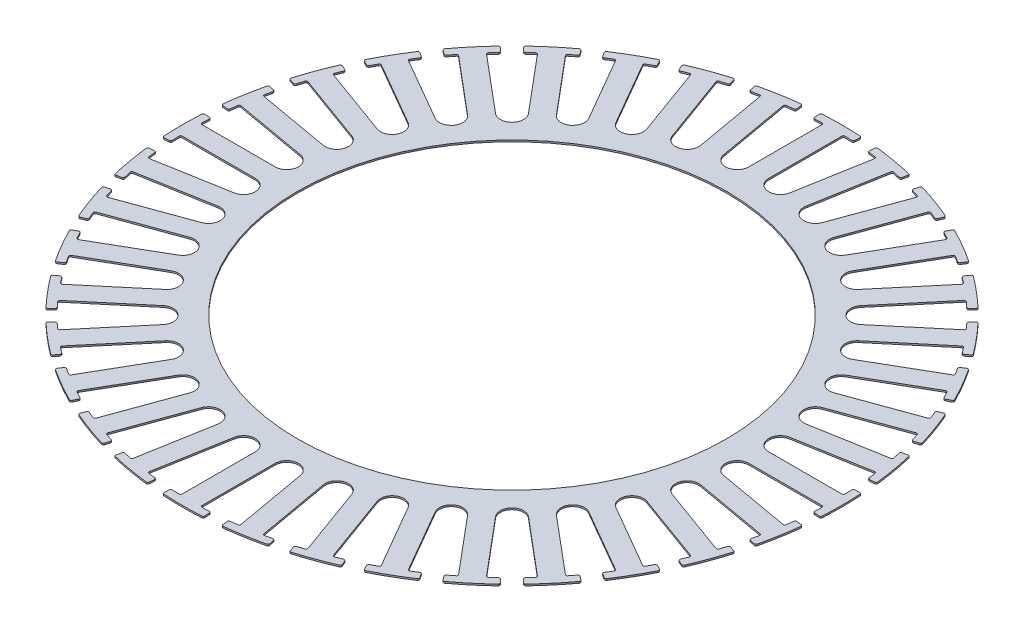
from build123d import *

# Parameters (mm, degrees)
P_IDAT_VYSUNUT_M1_DEPTH = 0.2
ZAOBLIT2_R              = 0.2
KRUHOV_POLE1_DEPTH      = 0.2


# Read off the part's stored shape, not the designer's step: Kruhové pole1
with BuildPart() as part:
    # Skica1 → Přidat vysunutím1 (new body)
    with BuildSketch(Plane(origin=(0, 0, 0), x_dir=(1, 0, 0), z_dir=(0, 1, 0))):
        with BuildLine():
            Line((-2.569801004, 41.420358796), (-2.507878089, 40.422277861))
            ThreePointArc((-2.507878089, 40.422277861), (-1.879166138, 40.456380642), (-1.25, 40.48070528))
            Line((-1.25, 40.48070528), (-1.25, 31.073947021))
            Line((-1.25, 31.073947021), (-1.085241159, 26.978181029))
            ThreePointArc((-1.085241159, 26.978181029), (1.270191917, 26.970105904), (3.615958065, 26.756771989))
            Line((3.615958065, 26.756771989), (4.164924582, 30.818924165))
            ThreePointArc((4.164924582, 30.818924165), (2.590619594, 29.610917461), (1.25, 31.073947021))
            Line((1.25, 31.073947021), (1.25, 40.48070528))
            ThreePointArc((1.25, 40.48070528), (1.879166138, 40.456380642), (2.507878089, 40.422277861))
            Line((2.507878089, 40.422277861), (2.569801004, 41.420358796))
            ThreePointArc((2.569801004, 41.420358796), (0, 41.5), (-2.569801004, 41.420358796))
        make_face()
    extrude(amount=P_IDAT_VYSUNUT_M1_DEPTH)

    # Zaoblit2
    zaoblit2_edges = [part.edges().sort_by_distance(p)[0] for p in [
        (-2.507878089, 0.1, -40.422277861),
        (-2.569801004, 0.1, -41.420358796),
        (2.569801004, 0.1, -41.420358796),
        (2.507878089, 0.1, -40.422277861),
        (1.25, 0.1, -40.48070528),
        (-1.25, 0.1, -40.48070528),
    ]]
    fillet(zaoblit2_edges, radius=ZAOBLIT2_R)

    # Kruhové pole1 outline → Kruhové pole1 (add)
    with BuildSketch(Plane(origin=(0, 0, 0), x_dir=(1, 0, 0), z_dir=(0, 1, 0))):
        with BuildLine():
            ThreePointArc((-9.535776959, 39.566639455), (-9.446113134, 39.443136268), (-9.295440541, 39.418837948))
            ThreePointArc((-9.295440541, 39.418837948), (-8.879840332, 39.514534486), (-8.463255471, 39.605849402))
            ThreePointArc((-8.463255471, 39.605849402), (-8.309712699, 39.576132918), (-8.224500066, 39.444994596))
            Line((-8.224500066, 39.444994596), (-6.626943964, 30.384803721))
            ThreePointArc((-6.626943964, 30.384803721), (-7.693144117, 28.711204717), (-9.453300038, 29.627483893))
            Line((-9.453300038, 29.627483893), (-12.599871307, 38.272617405))
            ThreePointArc((-12.599871307, 38.272617405), (-12.591644164, 38.42879284), (-12.473530464, 38.531299456))
            ThreePointArc((-12.473530464, 38.531299456), (-12.067099933, 38.66051085), (-11.659331326, 38.785435321))
            ThreePointArc((-11.659331326, 38.785435321), (-11.540994193, 38.88181458), (-11.525094636, 39.03360339))
            Line((-11.525094636, 39.03360339), (-11.695001824, 39.609051142))
            ThreePointArc((-11.695001824, 39.609051142), (-11.791655425, 39.728326768), (-11.94437873, 39.74395321))
            ThreePointArc((-11.94437873, 39.74395321), (-14.193835948, 38.997243763), (-16.396995731, 38.123333157))
            ThreePointArc((-16.396995731, 38.123333157), (-16.503944086, 38.01319396), (-16.501316146, 37.859695792))
            Line((-16.501316146, 37.859695792), (-16.261581918, 37.309663005))
            ThreePointArc((-16.261581918, 37.309663005), (-16.151834185, 37.203606068), (-15.999231288, 37.205840915))
            ThreePointArc((-15.999231288, 37.205840915), (-15.60656251, 37.372251827), (-15.212163177, 37.534518666))
            ThreePointArc((-15.212163177, 37.534518666), (-15.055792851, 37.531916065), (-14.949102859, 37.417567047))
            Line((-14.949102859, 37.417567047), (-11.80253159, 28.772433535))
            ThreePointArc((-11.80253159, 28.772433535), (-12.56191635, 26.939116547), (-14.454441756, 27.535827516))
            Line((-14.454441756, 27.535827516), (-19.054421217, 35.503225657))
            ThreePointArc((-19.054421217, 35.503225657), (-19.073438642, 35.658457064), (-18.974919442, 35.779916603))
            ThreePointArc((-18.974919442, 35.779916603), (-18.597100828, 35.977740907), (-18.217220048, 36.17157577))
            ThreePointArc((-18.217220048, 36.17157577), (-18.117416804, 36.28703984), (-18.128116648, 36.439283566))
            Line((-18.128116648, 36.439283566), (-18.395368018, 36.976484899))
            ThreePointArc((-18.395368018, 36.976484899), (-18.511265228, 37.077164739), (-18.664381826, 37.066033657))
            ThreePointArc((-18.664381826, 37.066033657), (-20.75, 35.940054257), (-22.767935851, 34.696845636))
            ThreePointArc((-22.767935851, 34.696845636), (-22.85413395, 34.569808313), (-22.824891256, 34.419098465))
            Line((-22.824891256, 34.419098465), (-22.493286939, 33.919051323))
            ThreePointArc((-22.493286939, 33.919051323), (-22.366789927, 33.833663123), (-22.216893488, 33.862363233))
            ThreePointArc((-22.216893488, 33.862363233), (-21.859087183, 34.094432207), (-21.498857003, 34.322720574))
            ThreePointArc((-21.498857003, 34.322720574), (-21.344410357, 34.347310934), (-21.219484727, 34.253225657))
            Line((-21.219484727, 34.253225657), (-16.619505265, 26.285827516))
            ThreePointArc((-16.619505265, 26.285827516), (-17.049001111, 24.348496953), (-19.016392575, 24.607508953))
            Line((-19.016392575, 24.607508953), (-24.930012181, 31.655086363))
            ThreePointArc((-24.930012181, 31.655086363), (-24.975696339, 31.804657116), (-24.899765095, 31.941379091))
            ThreePointArc((-24.899765095, 31.941379091), (-24.562038224, 32.201805513), (-24.221587758, 32.458661194))
            ThreePointArc((-24.221587758, 32.458661194), (-24.143350875, 32.589701756), (-24.180325009, 32.737774549))
            Line((-24.180325009, 32.737774549), (-24.536800263, 33.220406874))
            ThreePointArc((-24.536800263, 33.220406874), (-24.668419605, 33.299431821), (-24.817277126, 33.261881427))
            ThreePointArc((-24.817277126, 33.261881427), (-26.675685802, 31.790844389), (-28.447083762, 30.216112018))
            ThreePointArc((-28.447083762, 30.216112018), (-28.509912518, 30.076036535), (-28.454943596, 29.932694248))
            Line((-28.454943596, 29.932694248), (-28.041544819, 29.497826431))
            ThreePointArc((-28.041544819, 29.497826431), (-27.902142075, 29.435701446), (-27.759506622, 29.48999478))
            ThreePointArc((-27.759506622, 29.48999478), (-27.447434553, 29.780670518), (-27.132318937, 30.068043985))
            ThreePointArc((-27.132318937, 30.068043985), (-26.984488754, 30.119080141), (-26.845123288, 30.048117339))
            Line((-26.845123288, 30.048117339), (-20.931503683, 23.000539929))
            ThreePointArc((-20.931503683, 23.000539929), (-21.0180606, 21.0180606), (-23.000539929, 20.931503683))
            Line((-23.000539929, 20.931503683), (-30.048117339, 26.845123288))
            ThreePointArc((-30.048117339, 26.845123288), (-30.119080141, 26.984488754), (-30.068043985, 27.132318937))
            ThreePointArc((-30.068043985, 27.132318937), (-29.780670518, 27.447434553), (-29.48999478, 27.759506622))
            ThreePointArc((-29.48999478, 27.759506622), (-29.435701446, 27.902142075), (-29.497826431, 28.041544819))
            Line((-29.497826431, 28.041544819), (-29.932694248, 28.454943596))
            ThreePointArc((-29.932694248, 28.454943596), (-30.076036535, 28.509912518), (-30.216112018, 28.447083762))
            ThreePointArc((-30.216112018, 28.447083762), (-31.790844389, 26.675685802), (-33.261881427, 24.817277126))
            ThreePointArc((-33.261881427, 24.817277126), (-33.299431821, 24.668419605), (-33.220406874, 24.536800263))
            Line((-33.220406874, 24.536800263), (-32.737774549, 24.180325009))
            ThreePointArc((-32.737774549, 24.180325009), (-32.589701756, 24.143350875), (-32.458661194, 24.221587758))
            ThreePointArc((-32.458661194, 24.221587758), (-32.201805513, 24.562038224), (-31.941379091, 24.899765095))
            ThreePointArc((-31.941379091, 24.899765095), (-31.804657116, 24.975696339), (-31.655086363, 24.930012181))
            Line((-31.655086363, 24.930012181), (-24.607508953, 19.016392575))
            ThreePointArc((-24.607508953, 19.016392575), (-24.348496953, 17.049001111), (-26.285827516, 16.619505265))
            Line((-26.285827516, 16.619505265), (-34.253225657, 21.219484727))
            ThreePointArc((-34.253225657, 21.219484727), (-34.347310934, 21.344410357), (-34.322720574, 21.498857003))
            ThreePointArc((-34.322720574, 21.498857003), (-34.094432207, 21.859087183), (-33.862363233, 22.216893488))
            ThreePointArc((-33.862363233, 22.216893488), (-33.833663123, 22.366789927), (-33.919051323, 22.493286939))
            Line((-33.919051323, 22.493286939), (-34.419098465, 22.824891256))
            ThreePointArc((-34.419098465, 22.824891256), (-34.569808313, 22.85413395), (-34.696845636, 22.767935851))
            ThreePointArc((-34.696845636, 22.767935851), (-35.940054257, 20.75), (-37.066033657, 18.664381826))
            ThreePointArc((-37.066033657, 18.664381826), (-37.077164739, 18.511265228), (-36.976484899, 18.395368018))
            Line((-36.976484899, 18.395368018), (-36.439283566, 18.128116648))
            ThreePointArc((-36.439283566, 18.128116648), (-36.28703984, 18.117416804), (-36.17157577, 18.217220048))
            ThreePointArc((-36.17157577, 18.217220048), (-35.977740907, 18.597100828), (-35.779916603, 18.974919442))
            ThreePointArc((-35.779916603, 18.974919442), (-35.658457064, 19.073438642), (-35.503225657, 19.054421217))
            Line((-35.503225657, 19.054421217), (-27.535827516, 14.454441756))
            ThreePointArc((-27.535827516, 14.454441756), (-26.939116547, 12.56191635), (-28.772433535, 11.80253159))
            Line((-28.772433535, 11.80253159), (-37.417567047, 14.949102859))
            ThreePointArc((-37.417567047, 14.949102859), (-37.531916065, 15.055792851), (-37.534518666, 15.212163177))
            ThreePointArc((-37.534518666, 15.212163177), (-37.372251827, 15.60656251), (-37.205840915, 15.999231288))
            ThreePointArc((-37.205840915, 15.999231288), (-37.203606068, 16.151834185), (-37.309663005, 16.261581918))
            Line((-37.309663005, 16.261581918), (-37.859695792, 16.501316146))
            ThreePointArc((-37.859695792, 16.501316146), (-38.01319396, 16.503944086), (-38.123333157, 16.396995731))
            ThreePointArc((-38.123333157, 16.396995731), (-38.997243763, 14.193835948), (-39.74395321, 11.94437873))
            ThreePointArc((-39.74395321, 11.94437873), (-39.728326768, 11.791655425), (-39.609051142, 11.695001824))
            Line((-39.609051142, 11.695001824), (-39.03360339, 11.525094636))
            ThreePointArc((-39.03360339, 11.525094636), (-38.88181458, 11.540994193), (-38.785435321, 11.659331326))
            ThreePointArc((-38.785435321, 11.659331326), (-38.66051085, 12.067099933), (-38.531299456, 12.473530464))
            ThreePointArc((-38.531299456, 12.473530464), (-38.42879284, 12.591644164), (-38.272617405, 12.599871307))
            Line((-38.272617405, 12.599871307), (-29.627483893, 9.453300038))
            ThreePointArc((-29.627483893, 9.453300038), (-28.711204717, 7.693144117), (-30.384803721, 6.626943964))
            Line((-30.384803721, 6.626943964), (-39.444994596, 8.224500066))
            ThreePointArc((-39.444994596, 8.224500066), (-39.576132918, 8.309712699), (-39.605849402, 8.463255471))
            ThreePointArc((-39.605849402, 8.463255471), (-39.514534486, 8.879840332), (-39.418837948, 9.295440541))
            ThreePointArc((-39.418837948, 9.295440541), (-39.443136268, 9.446113134), (-39.566639455, 9.535776959))
            Line((-39.566639455, 9.535776959), (-40.14994542, 9.676356894))
            ThreePointArc((-40.14994542, 9.676356894), (-40.301567943, 9.652290233), (-40.391462492, 9.527841192))
            ThreePointArc((-40.391462492, 9.527841192), (-40.86952175, 7.206399373), (-41.214272856, 4.86145173))
            ThreePointArc((-41.214272856, 4.86145173), (-41.172363691, 4.713762138), (-41.038116408, 4.639288918))
            Line((-41.038116408, 4.639288918), (-40.441906928, 4.571888455))
            ThreePointArc((-40.441906928, 4.571888455), (-40.29518506, 4.613904312), (-40.220819046, 4.747179721))
            ThreePointArc((-40.220819046, 4.747179721), (-40.168600734, 5.170446314), (-40.111928272, 5.593139575))
            ThreePointArc((-40.111928272, 5.593139575), (-40.03148919, 5.727258949), (-39.87911504, 5.762480683))
            Line((-39.87911504, 5.762480683), (-30.818924165, 4.164924582))
            ThreePointArc((-30.818924165, 4.164924582), (-29.610917461, 2.590619594), (-31.073947021, 1.25))
            Line((-31.073947021, 1.25), (-40.273905944, 1.25))
            ThreePointArc((-40.273905944, 1.25), (-40.417848999, 1.311146131), (-40.473776445, 1.45719603))
            ThreePointArc((-40.473776445, 1.45719603), (-40.45618801, 1.8833087), (-40.434113536, 2.309212537))
            ThreePointArc((-40.434113536, 2.309212537), (-40.484206732, 2.453376716), (-40.621403588, 2.520232243))
            Line((-40.621403588, 2.520232243), (-41.220259274, 2.557386434))
            ThreePointArc((-41.220259274, 2.557386434), (-41.365399178, 2.507356425), (-41.432317677, 2.369188021))
            ThreePointArc((-41.432317677, 2.369188021), (-41.5, 0), (-41.432317677, -2.369188021))
            ThreePointArc((-41.432317677, -2.369188021), (-41.365399178, -2.507356425), (-41.220259274, -2.557386434))
            Line((-41.220259274, -2.557386434), (-40.621403588, -2.520232243))
            ThreePointArc((-40.621403588, -2.520232243), (-40.484206732, -2.453376716), (-40.434113536, -2.309212537))
            ThreePointArc((-40.434113536, -2.309212537), (-40.45618801, -1.8833087), (-40.473776445, -1.45719603))
            ThreePointArc((-40.473776445, -1.45719603), (-40.417848999, -1.311146131), (-40.273905944, -1.25))
            Line((-40.273905944, -1.25), (-31.073947021, -1.25))
            ThreePointArc((-31.073947021, -1.25), (-29.610917461, -2.590619594), (-30.818924165, -4.164924582))
            Line((-30.818924165, -4.164924582), (-39.87911504, -5.762480683))
            ThreePointArc((-39.87911504, -5.762480683), (-40.03148919, -5.727258949), (-40.111928272, -5.593139575))
            ThreePointArc((-40.111928272, -5.593139575), (-40.168600734, -5.170446314), (-40.220819046, -4.747179721))
            ThreePointArc((-40.220819046, -4.747179721), (-40.29518506, -4.613904312), (-40.441906928, -4.571888455))
            Line((-40.441906928, -4.571888455), (-41.038116408, -4.639288918))
            ThreePointArc((-41.038116408, -4.639288918), (-41.172363691, -4.713762138), (-41.214272856, -4.86145173))
            ThreePointArc((-41.214272856, -4.86145173), (-40.86952175, -7.206399373), (-40.391462492, -9.527841192))
            ThreePointArc((-40.391462492, -9.527841192), (-40.301567943, -9.652290233), (-40.14994542, -9.676356894))
            Line((-40.14994542, -9.676356894), (-39.566639455, -9.535776959))
            ThreePointArc((-39.566639455, -9.535776959), (-39.443136268, -9.446113134), (-39.418837948, -9.295440541))
            ThreePointArc((-39.418837948, -9.295440541), (-39.514534486, -8.879840332), (-39.605849402, -8.463255471))
            ThreePointArc((-39.605849402, -8.463255471), (-39.576132918, -8.309712699), (-39.444994596, -8.224500066))
            Line((-39.444994596, -8.224500066), (-30.384803721, -6.626943964))
            ThreePointArc((-30.384803721, -6.626943964), (-28.711204717, -7.693144117), (-29.627483893, -9.453300038))
            Line((-29.627483893, -9.453300038), (-38.272617405, -12.599871307))
            ThreePointArc((-38.272617405, -12.599871307), (-38.42879284, -12.591644164), (-38.531299456, -12.473530464))
            ThreePointArc((-38.531299456, -12.473530464), (-38.66051085, -12.067099933), (-38.785435321, -11.659331326))
            ThreePointArc((-38.785435321, -11.659331326), (-38.88181458, -11.540994193), (-39.03360339, -11.525094636))
            Line((-39.03360339, -11.525094636), (-39.609051142, -11.695001824))
            ThreePointArc((-39.609051142, -11.695001824), (-39.728326768, -11.791655425), (-39.74395321, -11.94437873))
            ThreePointArc((-39.74395321, -11.94437873), (-38.997243763, -14.193835948), (-38.123333157, -16.396995731))
            ThreePointArc((-38.123333157, -16.396995731), (-38.01319396, -16.503944086), (-37.859695792, -16.501316146))
            Line((-37.859695792, -16.501316146), (-37.309663005, -16.261581918))
            ThreePointArc((-37.309663005, -16.261581918), (-37.203606068, -16.151834185), (-37.205840915, -15.999231288))
            ThreePointArc((-37.205840915, -15.999231288), (-37.372251827, -15.60656251), (-37.534518666, -15.212163177))
            ThreePointArc((-37.534518666, -15.212163177), (-37.531916065, -15.055792851), (-37.417567047, -14.949102859))
            Line((-37.417567047, -14.949102859), (-28.772433535, -11.80253159))
            ThreePointArc((-28.772433535, -11.80253159), (-26.939116547, -12.56191635), (-27.535827516, -14.454441756))
            Line((-27.535827516, -14.454441756), (-35.503225657, -19.054421217))
            ThreePointArc((-35.503225657, -19.054421217), (-35.658457064, -19.073438642), (-35.779916603, -18.974919442))
            ThreePointArc((-35.779916603, -18.974919442), (-35.977740907, -18.597100828), (-36.17157577, -18.217220048))
            ThreePointArc((-36.17157577, -18.217220048), (-36.28703984, -18.117416804), (-36.439283566, -18.128116648))
            Line((-36.439283566, -18.128116648), (-36.976484899, -18.395368018))
            ThreePointArc((-36.976484899, -18.395368018), (-37.077164739, -18.511265228), (-37.066033657, -18.664381826))
            ThreePointArc((-37.066033657, -18.664381826), (-35.940054257, -20.75), (-34.696845636, -22.767935851))
            ThreePointArc((-34.696845636, -22.767935851), (-34.569808313, -22.85413395), (-34.419098465, -22.824891256))
            Line((-34.419098465, -22.824891256), (-33.919051323, -22.493286939))
            ThreePointArc((-33.919051323, -22.493286939), (-33.833663123, -22.366789927), (-33.862363233, -22.216893488))
            ThreePointArc((-33.862363233, -22.216893488), (-34.094432207, -21.859087183), (-34.322720574, -21.498857003))
            ThreePointArc((-34.322720574, -21.498857003), (-34.347310934, -21.344410357), (-34.253225657, -21.219484727))
            Line((-34.253225657, -21.219484727), (-26.285827516, -16.619505265))
            ThreePointArc((-26.285827516, -16.619505265), (-24.348496953, -17.049001111), (-24.607508953, -19.016392575))
            Line((-24.607508953, -19.016392575), (-31.655086363, -24.930012181))
            ThreePointArc((-31.655086363, -24.930012181), (-31.804657116, -24.975696339), (-31.941379091, -24.899765095))
            ThreePointArc((-31.941379091, -24.899765095), (-32.201805513, -24.562038224), (-32.458661194, -24.221587758))
            ThreePointArc((-32.458661194, -24.221587758), (-32.589701756, -24.143350875), (-32.737774549, -24.180325009))
            Line((-32.737774549, -24.180325009), (-33.220406874, -24.536800263))
            ThreePointArc((-33.220406874, -24.536800263), (-33.299431821, -24.668419605), (-33.261881427, -24.817277126))
            ThreePointArc((-33.261881427, -24.817277126), (-31.790844389, -26.675685802), (-30.216112018, -28.447083762))
            ThreePointArc((-30.216112018, -28.447083762), (-30.076036535, -28.509912518), (-29.932694248, -28.454943596))
            Line((-29.932694248, -28.454943596), (-29.497826431, -28.041544819))
            ThreePointArc((-29.497826431, -28.041544819), (-29.435701446, -27.902142075), (-29.48999478, -27.759506622))
            ThreePointArc((-29.48999478, -27.759506622), (-29.780670518, -27.447434553), (-30.068043985, -27.132318937))
            ThreePointArc((-30.068043985, -27.132318937), (-30.119080141, -26.984488754), (-30.048117339, -26.845123288))
            Line((-30.048117339, -26.845123288), (-23.000539929, -20.931503683))
            ThreePointArc((-23.000539929, -20.931503683), (-21.0180606, -21.0180606), (-20.931503683, -23.000539929))
            Line((-20.931503683, -23.000539929), (-26.845123288, -30.048117339))
            ThreePointArc((-26.845123288, -30.048117339), (-26.984488754, -30.119080141), (-27.132318937, -30.068043985))
            ThreePointArc((-27.132318937, -30.068043985), (-27.447434553, -29.780670518), (-27.759506622, -29.48999478))
            ThreePointArc((-27.759506622, -29.48999478), (-27.902142075, -29.435701446), (-28.041544819, -29.497826431))
            Line((-28.041544819, -29.497826431), (-28.454943596, -29.932694248))
            ThreePointArc((-28.454943596, -29.932694248), (-28.509912518, -30.076036535), (-28.447083762, -30.216112018))
            ThreePointArc((-28.447083762, -30.216112018), (-26.675685802, -31.790844389), (-24.817277126, -33.261881427))
            ThreePointArc((-24.817277126, -33.261881427), (-24.668419605, -33.299431821), (-24.536800263, -33.220406874))
            Line((-24.536800263, -33.220406874), (-24.180325009, -32.737774549))
            ThreePointArc((-24.180325009, -32.737774549), (-24.143350875, -32.589701756), (-24.221587758, -32.458661194))
            ThreePointArc((-24.221587758, -32.458661194), (-24.562038224, -32.201805513), (-24.899765095, -31.941379091))
            ThreePointArc((-24.899765095, -31.941379091), (-24.975696339, -31.804657116), (-24.930012181, -31.655086363))
            Line((-24.930012181, -31.655086363), (-19.016392575, -24.607508953))
            ThreePointArc((-19.016392575, -24.607508953), (-17.049001111, -24.348496953), (-16.619505265, -26.285827516))
            Line((-16.619505265, -26.285827516), (-21.219484727, -34.253225657))
            ThreePointArc((-21.219484727, -34.253225657), (-21.344410357, -34.347310934), (-21.498857003, -34.322720574))
            ThreePointArc((-21.498857003, -34.322720574), (-21.859087183, -34.094432207), (-22.216893488, -33.862363233))
            ThreePointArc((-22.216893488, -33.862363233), (-22.366789927, -33.833663123), (-22.493286939, -33.919051323))
            Line((-22.493286939, -33.919051323), (-22.824891256, -34.419098465))
            ThreePointArc((-22.824891256, -34.419098465), (-22.85413395, -34.569808313), (-22.767935851, -34.696845636))
            ThreePointArc((-22.767935851, -34.696845636), (-20.75, -35.940054257), (-18.664381826, -37.066033657))
            ThreePointArc((-18.664381826, -37.066033657), (-18.511265228, -37.077164739), (-18.395368018, -36.976484899))
            Line((-18.395368018, -36.976484899), (-18.128116648, -36.439283566))
            ThreePointArc((-18.128116648, -36.439283566), (-18.117416804, -36.28703984), (-18.217220048, -36.17157577))
            ThreePointArc((-18.217220048, -36.17157577), (-18.597100828, -35.977740907), (-18.974919442, -35.779916603))
            ThreePointArc((-18.974919442, -35.779916603), (-19.073438642, -35.658457064), (-19.054421217, -35.503225657))
            Line((-19.054421217, -35.503225657), (-14.454441756, -27.535827516))
            ThreePointArc((-14.454441756, -27.535827516), (-12.56191635, -26.939116547), (-11.80253159, -28.772433535))
            Line((-11.80253159, -28.772433535), (-14.949102859, -37.417567047))
            ThreePointArc((-14.949102859, -37.417567047), (-15.055792851, -37.531916065), (-15.212163177, -37.534518666))
            ThreePointArc((-15.212163177, -37.534518666), (-15.60656251, -37.372251827), (-15.999231288, -37.205840915))
            ThreePointArc((-15.999231288, -37.205840915), (-16.151834185, -37.203606068), (-16.261581918, -37.309663005))
            Line((-16.261581918, -37.309663005), (-16.501316146, -37.859695792))
            ThreePointArc((-16.501316146, -37.859695792), (-16.503944086, -38.01319396), (-16.396995731, -38.123333157))
            ThreePointArc((-16.396995731, -38.123333157), (-14.193835948, -38.997243763), (-11.94437873, -39.74395321))
            ThreePointArc((-11.94437873, -39.74395321), (-11.791655425, -39.728326768), (-11.695001824, -39.609051142))
            Line((-11.695001824, -39.609051142), (-11.525094636, -39.03360339))
            ThreePointArc((-11.525094636, -39.03360339), (-11.540994193, -38.88181458), (-11.659331326, -38.785435321))
            ThreePointArc((-11.659331326, -38.785435321), (-12.067099933, -38.66051085), (-12.473530464, -38.531299456))
            ThreePointArc((-12.473530464, -38.531299456), (-12.591644164, -38.42879284), (-12.599871307, -38.272617405))
            Line((-12.599871307, -38.272617405), (-9.453300038, -29.627483893))
            ThreePointArc((-9.453300038, -29.627483893), (-7.693144117, -28.711204717), (-6.626943964, -30.384803721))
            Line((-6.626943964, -30.384803721), (-8.224500066, -39.444994596))
            ThreePointArc((-8.224500066, -39.444994596), (-8.309712699, -39.576132918), (-8.463255471, -39.605849402))
            ThreePointArc((-8.463255471, -39.605849402), (-8.879840332, -39.514534486), (-9.295440541, -39.418837948))
            ThreePointArc((-9.295440541, -39.418837948), (-9.446113134, -39.443136268), (-9.535776959, -39.566639455))
            Line((-9.535776959, -39.566639455), (-9.676356894, -40.14994542))
            ThreePointArc((-9.676356894, -40.14994542), (-9.652290233, -40.301567943), (-9.527841192, -40.391462492))
            ThreePointArc((-9.527841192, -40.391462492), (-7.206399373, -40.86952175), (-4.86145173, -41.214272856))
            ThreePointArc((-4.86145173, -41.214272856), (-4.713762138, -41.172363691), (-4.639288918, -41.038116408))
            Line((-4.639288918, -41.038116408), (-4.571888455, -40.441906928))
            ThreePointArc((-4.571888455, -40.441906928), (-4.613904312, -40.29518506), (-4.747179721, -40.220819046))
            ThreePointArc((-4.747179721, -40.220819046), (-5.170446314, -40.168600734), (-5.593139575, -40.111928272))
            ThreePointArc((-5.593139575, -40.111928272), (-5.727258949, -40.03148919), (-5.762480683, -39.87911504))
            Line((-5.762480683, -39.87911504), (-4.164924582, -30.818924165))
            ThreePointArc((-4.164924582, -30.818924165), (-2.590619594, -29.610917461), (-1.25, -31.073947021))
            Line((-1.25, -31.073947021), (-1.25, -40.273905944))
            ThreePointArc((-1.25, -40.273905944), (-1.311146131, -40.417848999), (-1.45719603, -40.473776445))
            ThreePointArc((-1.45719603, -40.473776445), (-1.8833087, -40.45618801), (-2.309212537, -40.434113536))
            ThreePointArc((-2.309212537, -40.434113536), (-2.453376716, -40.484206732), (-2.520232243, -40.621403588))
            Line((-2.520232243, -40.621403588), (-2.557386434, -41.220259274))
            ThreePointArc((-2.557386434, -41.220259274), (-2.507356425, -41.365399178), (-2.369188021, -41.432317677))
            ThreePointArc((-2.369188021, -41.432317677), (0, -41.5), (2.369188021, -41.432317677))
            ThreePointArc((2.369188021, -41.432317677), (2.507356425, -41.365399178), (2.557386434, -41.220259274))
            Line((2.557386434, -41.220259274), (2.520232243, -40.621403588))
            ThreePointArc((2.520232243, -40.621403588), (2.453376716, -40.484206732), (2.309212537, -40.434113536))
            ThreePointArc((2.309212537, -40.434113536), (1.8833087, -40.45618801), (1.45719603, -40.473776445))
            ThreePointArc((1.45719603, -40.473776445), (1.311146131, -40.417848999), (1.25, -40.273905944))
            Line((1.25, -40.273905944), (1.25, -31.073947021))
            ThreePointArc((1.25, -31.073947021), (2.590619594, -29.610917461), (4.164924582, -30.818924165))
            Line((4.164924582, -30.818924165), (5.762480683, -39.87911504))
            ThreePointArc((5.762480683, -39.87911504), (5.727258949, -40.03148919), (5.593139575, -40.111928272))
            ThreePointArc((5.593139575, -40.111928272), (5.170446314, -40.168600734), (4.747179721, -40.220819046))
            ThreePointArc((4.747179721, -40.220819046), (4.613904312, -40.29518506), (4.571888455, -40.441906928))
            Line((4.571888455, -40.441906928), (4.639288918, -41.038116408))
            ThreePointArc((4.639288918, -41.038116408), (4.713762138, -41.172363691), (4.86145173, -41.214272856))
            ThreePointArc((4.86145173, -41.214272856), (7.206399373, -40.86952175), (9.527841192, -40.391462492))
            ThreePointArc((9.527841192, -40.391462492), (9.652290233, -40.301567943), (9.676356894, -40.14994542))
            Line((9.676356894, -40.14994542), (9.535776959, -39.566639455))
            ThreePointArc((9.535776959, -39.566639455), (9.446113134, -39.443136268), (9.295440541, -39.418837948))
            ThreePointArc((9.295440541, -39.418837948), (8.879840332, -39.514534486), (8.463255471, -39.605849402))
            ThreePointArc((8.463255471, -39.605849402), (8.309712699, -39.576132918), (8.224500066, -39.444994596))
            Line((8.224500066, -39.444994596), (6.626943964, -30.384803721))
            ThreePointArc((6.626943964, -30.384803721), (7.693144117, -28.711204717), (9.453300038, -29.627483893))
            Line((9.453300038, -29.627483893), (12.599871307, -38.272617405))
            ThreePointArc((12.599871307, -38.272617405), (12.591644164, -38.42879284), (12.473530464, -38.531299456))
            ThreePointArc((12.473530464, -38.531299456), (12.067099933, -38.66051085), (11.659331326, -38.785435321))
            ThreePointArc((11.659331326, -38.785435321), (11.540994193, -38.88181458), (11.525094636, -39.03360339))
            Line((11.525094636, -39.03360339), (11.695001824, -39.609051142))
            ThreePointArc((11.695001824, -39.609051142), (11.791655425, -39.728326768), (11.94437873, -39.74395321))
            ThreePointArc((11.94437873, -39.74395321), (14.193835948, -38.997243763), (16.396995731, -38.123333157))
            ThreePointArc((16.396995731, -38.123333157), (16.503944086, -38.01319396), (16.501316146, -37.859695792))
            Line((16.501316146, -37.859695792), (16.261581918, -37.309663005))
            ThreePointArc((16.261581918, -37.309663005), (16.151834185, -37.203606068), (15.999231288, -37.205840915))
            ThreePointArc((15.999231288, -37.205840915), (15.60656251, -37.372251827), (15.212163177, -37.534518666))
            ThreePointArc((15.212163177, -37.534518666), (15.055792851, -37.531916065), (14.949102859, -37.417567047))
            Line((14.949102859, -37.417567047), (11.80253159, -28.772433535))
            ThreePointArc((11.80253159, -28.772433535), (12.56191635, -26.939116547), (14.454441756, -27.535827516))
            Line((14.454441756, -27.535827516), (19.054421217, -35.503225657))
            ThreePointArc((19.054421217, -35.503225657), (19.073438642, -35.658457064), (18.974919442, -35.779916603))
            ThreePointArc((18.974919442, -35.779916603), (18.597100828, -35.977740907), (18.217220048, -36.17157577))
            ThreePointArc((18.217220048, -36.17157577), (18.117416804, -36.28703984), (18.128116648, -36.439283566))
            Line((18.128116648, -36.439283566), (18.395368018, -36.976484899))
            ThreePointArc((18.395368018, -36.976484899), (18.511265228, -37.077164739), (18.664381826, -37.066033657))
            ThreePointArc((18.664381826, -37.066033657), (20.75, -35.940054257), (22.767935851, -34.696845636))
            ThreePointArc((22.767935851, -34.696845636), (22.85413395, -34.569808313), (22.824891256, -34.419098465))
            Line((22.824891256, -34.419098465), (22.493286939, -33.919051323))
            ThreePointArc((22.493286939, -33.919051323), (22.366789927, -33.833663123), (22.216893488, -33.862363233))
            ThreePointArc((22.216893488, -33.862363233), (21.859087183, -34.094432207), (21.498857003, -34.322720574))
            ThreePointArc((21.498857003, -34.322720574), (21.344410357, -34.347310934), (21.219484727, -34.253225657))
            Line((21.219484727, -34.253225657), (16.619505265, -26.285827516))
            ThreePointArc((16.619505265, -26.285827516), (17.049001111, -24.348496953), (19.016392575, -24.607508953))
            Line((19.016392575, -24.607508953), (24.930012181, -31.655086363))
            ThreePointArc((24.930012181, -31.655086363), (24.975696339, -31.804657116), (24.899765095, -31.941379091))
            ThreePointArc((24.899765095, -31.941379091), (24.562038224, -32.201805513), (24.221587758, -32.458661194))
            ThreePointArc((24.221587758, -32.458661194), (24.143350875, -32.589701756), (24.180325009, -32.737774549))
            Line((24.180325009, -32.737774549), (24.536800263, -33.220406874))
            ThreePointArc((24.536800263, -33.220406874), (24.668419605, -33.299431821), (24.817277126, -33.261881427))
            ThreePointArc((24.817277126, -33.261881427), (26.675685802, -31.790844389), (28.447083762, -30.216112018))
            ThreePointArc((28.447083762, -30.216112018), (28.509912518, -30.076036535), (28.454943596, -29.932694248))
            Line((28.454943596, -29.932694248), (28.041544819, -29.497826431))
            ThreePointArc((28.041544819, -29.497826431), (27.902142075, -29.435701446), (27.759506622, -29.48999478))
            ThreePointArc((27.759506622, -29.48999478), (27.447434553, -29.780670518), (27.132318937, -30.068043985))
            ThreePointArc((27.132318937, -30.068043985), (26.984488754, -30.119080141), (26.845123288, -30.048117339))
            Line((26.845123288, -30.048117339), (20.931503683, -23.000539929))
            ThreePointArc((20.931503683, -23.000539929), (21.0180606, -21.0180606), (23.000539929, -20.931503683))
            Line((23.000539929, -20.931503683), (30.048117339, -26.845123288))
            ThreePointArc((30.048117339, -26.845123288), (30.119080141, -26.984488754), (30.068043985, -27.132318937))
            ThreePointArc((30.068043985, -27.132318937), (29.780670518, -27.447434553), (29.48999478, -27.759506622))
            ThreePointArc((29.48999478, -27.759506622), (29.435701446, -27.902142075), (29.497826431, -28.041544819))
            Line((29.497826431, -28.041544819), (29.932694248, -28.454943596))
            ThreePointArc((29.932694248, -28.454943596), (30.076036535, -28.509912518), (30.216112018, -28.447083762))
            ThreePointArc((30.216112018, -28.447083762), (31.790844389, -26.675685802), (33.261881427, -24.817277126))
            ThreePointArc((33.261881427, -24.817277126), (33.299431821, -24.668419605), (33.220406874, -24.536800263))
            Line((33.220406874, -24.536800263), (32.737774549, -24.180325009))
            ThreePointArc((32.737774549, -24.180325009), (32.589701756, -24.143350875), (32.458661194, -24.221587758))
            ThreePointArc((32.458661194, -24.221587758), (32.201805513, -24.562038224), (31.941379091, -24.899765095))
            ThreePointArc((31.941379091, -24.899765095), (31.804657116, -24.975696339), (31.655086363, -24.930012181))
            Line((31.655086363, -24.930012181), (24.607508953, -19.016392575))
            ThreePointArc((24.607508953, -19.016392575), (24.348496953, -17.049001111), (26.285827516, -16.619505265))
            Line((26.285827516, -16.619505265), (34.253225657, -21.219484727))
            ThreePointArc((34.253225657, -21.219484727), (34.347310934, -21.344410357), (34.322720574, -21.498857003))
            ThreePointArc((34.322720574, -21.498857003), (34.094432207, -21.859087183), (33.862363233, -22.216893488))
            ThreePointArc((33.862363233, -22.216893488), (33.833663123, -22.366789927), (33.919051323, -22.493286939))
            Line((33.919051323, -22.493286939), (34.419098465, -22.824891256))
            ThreePointArc((34.419098465, -22.824891256), (34.569808313, -22.85413395), (34.696845636, -22.767935851))
            ThreePointArc((34.696845636, -22.767935851), (35.940054257, -20.75), (37.066033657, -18.664381826))
            ThreePointArc((37.066033657, -18.664381826), (37.077164739, -18.511265228), (36.976484899, -18.395368018))
            Line((36.976484899, -18.395368018), (36.439283566, -18.128116648))
            ThreePointArc((36.439283566, -18.128116648), (36.28703984, -18.117416804), (36.17157577, -18.217220048))
            ThreePointArc((36.17157577, -18.217220048), (35.977740907, -18.597100828), (35.779916603, -18.974919442))
            ThreePointArc((35.779916603, -18.974919442), (35.658457064, -19.073438642), (35.503225657, -19.054421217))
            Line((35.503225657, -19.054421217), (27.535827516, -14.454441756))
            ThreePointArc((27.535827516, -14.454441756), (26.939116547, -12.56191635), (28.772433535, -11.80253159))
            Line((28.772433535, -11.80253159), (37.417567047, -14.949102859))
            ThreePointArc((37.417567047, -14.949102859), (37.531916065, -15.055792851), (37.534518666, -15.212163177))
            ThreePointArc((37.534518666, -15.212163177), (37.372251827, -15.60656251), (37.205840915, -15.999231288))
            ThreePointArc((37.205840915, -15.999231288), (37.203606068, -16.151834185), (37.309663005, -16.261581918))
            Line((37.309663005, -16.261581918), (37.859695792, -16.501316146))
            ThreePointArc((37.859695792, -16.501316146), (38.01319396, -16.503944086), (38.123333157, -16.396995731))
            ThreePointArc((38.123333157, -16.396995731), (38.997243763, -14.193835948), (39.74395321, -11.94437873))
            ThreePointArc((39.74395321, -11.94437873), (39.728326768, -11.791655425), (39.609051142, -11.695001824))
            Line((39.609051142, -11.695001824), (39.03360339, -11.525094636))
            ThreePointArc((39.03360339, -11.525094636), (38.88181458, -11.540994193), (38.785435321, -11.659331326))
            ThreePointArc((38.785435321, -11.659331326), (38.66051085, -12.067099933), (38.531299456, -12.473530464))
            ThreePointArc((38.531299456, -12.473530464), (38.42879284, -12.591644164), (38.272617405, -12.599871307))
            Line((38.272617405, -12.599871307), (29.627483893, -9.453300038))
            ThreePointArc((29.627483893, -9.453300038), (28.711204717, -7.693144117), (30.384803721, -6.626943964))
            Line((30.384803721, -6.626943964), (39.444994596, -8.224500066))
            ThreePointArc((39.444994596, -8.224500066), (39.576132918, -8.309712699), (39.605849402, -8.463255471))
            ThreePointArc((39.605849402, -8.463255471), (39.514534486, -8.879840332), (39.418837948, -9.295440541))
            ThreePointArc((39.418837948, -9.295440541), (39.443136268, -9.446113134), (39.566639455, -9.535776959))
            Line((39.566639455, -9.535776959), (40.14994542, -9.676356894))
            ThreePointArc((40.14994542, -9.676356894), (40.301567943, -9.652290233), (40.391462492, -9.527841192))
            ThreePointArc((40.391462492, -9.527841192), (40.86952175, -7.206399373), (41.214272856, -4.86145173))
            ThreePointArc((41.214272856, -4.86145173), (41.172363691, -4.713762138), (41.038116408, -4.639288918))
            Line((41.038116408, -4.639288918), (40.441906928, -4.571888455))
            ThreePointArc((40.441906928, -4.571888455), (40.29518506, -4.613904312), (40.220819046, -4.747179721))
            ThreePointArc((40.220819046, -4.747179721), (40.168600734, -5.170446314), (40.111928272, -5.593139575))
            ThreePointArc((40.111928272, -5.593139575), (40.03148919, -5.727258949), (39.87911504, -5.762480683))
            Line((39.87911504, -5.762480683), (30.818924165, -4.164924582))
            ThreePointArc((30.818924165, -4.164924582), (29.610917461, -2.590619594), (31.073947021, -1.25))
            Line((31.073947021, -1.25), (40.273905944, -1.25))
            ThreePointArc((40.273905944, -1.25), (40.417848999, -1.311146131), (40.473776445, -1.45719603))
            ThreePointArc((40.473776445, -1.45719603), (40.45618801, -1.8833087), (40.434113536, -2.309212537))
            ThreePointArc((40.434113536, -2.309212537), (40.484206732, -2.453376716), (40.621403588, -2.520232243))
            Line((40.621403588, -2.520232243), (41.220259274, -2.557386434))
            ThreePointArc((41.220259274, -2.557386434), (41.365399178, -2.507356425), (41.432317677, -2.369188021))
            ThreePointArc((41.432317677, -2.369188021), (41.5, 0), (41.432317677, 2.369188021))
            ThreePointArc((41.432317677, 2.369188021), (41.365399178, 2.507356425), (41.220259274, 2.557386434))
            Line((41.220259274, 2.557386434), (40.621403588, 2.520232243))
            ThreePointArc((40.621403588, 2.520232243), (40.484206732, 2.453376716), (40.434113536, 2.309212537))
            ThreePointArc((40.434113536, 2.309212537), (40.45618801, 1.8833087), (40.473776445, 1.45719603))
            ThreePointArc((40.473776445, 1.45719603), (40.417848999, 1.311146131), (40.273905944, 1.25))
            Line((40.273905944, 1.25), (31.073947021, 1.25))
            ThreePointArc((31.073947021, 1.25), (29.610917461, 2.590619594), (30.818924165, 4.164924582))
            Line((30.818924165, 4.164924582), (39.87911504, 5.762480683))
            ThreePointArc((39.87911504, 5.762480683), (40.03148919, 5.727258949), (40.111928272, 5.593139575))
            ThreePointArc((40.111928272, 5.593139575), (40.168600734, 5.170446314), (40.220819046, 4.747179721))
            ThreePointArc((40.220819046, 4.747179721), (40.29518506, 4.613904312), (40.441906928, 4.571888455))
            Line((40.441906928, 4.571888455), (41.038116408, 4.639288918))
            ThreePointArc((41.038116408, 4.639288918), (41.172363691, 4.713762138), (41.214272856, 4.86145173))
            ThreePointArc((41.214272856, 4.86145173), (40.86952175, 7.206399373), (40.391462492, 9.527841192))
            ThreePointArc((40.391462492, 9.527841192), (40.301567943, 9.652290233), (40.14994542, 9.676356894))
            Line((40.14994542, 9.676356894), (39.566639455, 9.535776959))
            ThreePointArc((39.566639455, 9.535776959), (39.443136268, 9.446113134), (39.418837948, 9.295440541))
            ThreePointArc((39.418837948, 9.295440541), (39.514534486, 8.879840332), (39.605849402, 8.463255471))
            ThreePointArc((39.605849402, 8.463255471), (39.576132918, 8.309712699), (39.444994596, 8.224500066))
            Line((39.444994596, 8.224500066), (30.384803721, 6.626943964))
            ThreePointArc((30.384803721, 6.626943964), (28.711204717, 7.693144117), (29.627483893, 9.453300038))
            Line((29.627483893, 9.453300038), (38.272617405, 12.599871307))
            ThreePointArc((38.272617405, 12.599871307), (38.42879284, 12.591644164), (38.531299456, 12.473530464))
            ThreePointArc((38.531299456, 12.473530464), (38.66051085, 12.067099933), (38.785435321, 11.659331326))
            ThreePointArc((38.785435321, 11.659331326), (38.88181458, 11.540994193), (39.03360339, 11.525094636))
            Line((39.03360339, 11.525094636), (39.609051142, 11.695001824))
            ThreePointArc((39.609051142, 11.695001824), (39.728326768, 11.791655425), (39.74395321, 11.94437873))
            ThreePointArc((39.74395321, 11.94437873), (38.997243763, 14.193835948), (38.123333157, 16.396995731))
            ThreePointArc((38.123333157, 16.396995731), (38.01319396, 16.503944086), (37.859695792, 16.501316146))
            Line((37.859695792, 16.501316146), (37.309663005, 16.261581918))
            ThreePointArc((37.309663005, 16.261581918), (37.203606068, 16.151834185), (37.205840915, 15.999231288))
            ThreePointArc((37.205840915, 15.999231288), (37.372251827, 15.60656251), (37.534518666, 15.212163177))
            ThreePointArc((37.534518666, 15.212163177), (37.531916065, 15.055792851), (37.417567047, 14.949102859))
            Line((37.417567047, 14.949102859), (28.772433535, 11.80253159))
            ThreePointArc((28.772433535, 11.80253159), (26.939116547, 12.56191635), (27.535827516, 14.454441756))
            Line((27.535827516, 14.454441756), (35.503225657, 19.054421217))
            ThreePointArc((35.503225657, 19.054421217), (35.658457064, 19.073438642), (35.779916603, 18.974919442))
            ThreePointArc((35.779916603, 18.974919442), (35.977740907, 18.597100828), (36.17157577, 18.217220048))
            ThreePointArc((36.17157577, 18.217220048), (36.28703984, 18.117416804), (36.439283566, 18.128116648))
            Line((36.439283566, 18.128116648), (36.976484899, 18.395368018))
            ThreePointArc((36.976484899, 18.395368018), (37.077164739, 18.511265228), (37.066033657, 18.664381826))
            ThreePointArc((37.066033657, 18.664381826), (35.940054257, 20.75), (34.696845636, 22.767935851))
            ThreePointArc((34.696845636, 22.767935851), (34.569808313, 22.85413395), (34.419098465, 22.824891256))
            Line((34.419098465, 22.824891256), (33.919051323, 22.493286939))
            ThreePointArc((33.919051323, 22.493286939), (33.833663123, 22.366789927), (33.862363233, 22.216893488))
            ThreePointArc((33.862363233, 22.216893488), (34.094432207, 21.859087183), (34.322720574, 21.498857003))
            ThreePointArc((34.322720574, 21.498857003), (34.347310934, 21.344410357), (34.253225657, 21.219484727))
            Line((34.253225657, 21.219484727), (26.285827516, 16.619505265))
            ThreePointArc((26.285827516, 16.619505265), (24.348496953, 17.049001111), (24.607508953, 19.016392575))
            Line((24.607508953, 19.016392575), (31.655086363, 24.930012181))
            ThreePointArc((31.655086363, 24.930012181), (31.804657116, 24.975696339), (31.941379091, 24.899765095))
            ThreePointArc((31.941379091, 24.899765095), (32.201805513, 24.562038224), (32.458661194, 24.221587758))
            ThreePointArc((32.458661194, 24.221587758), (32.589701756, 24.143350875), (32.737774549, 24.180325009))
            Line((32.737774549, 24.180325009), (33.220406874, 24.536800263))
            ThreePointArc((33.220406874, 24.536800263), (33.299431821, 24.668419605), (33.261881427, 24.817277126))
            ThreePointArc((33.261881427, 24.817277126), (31.790844389, 26.675685802), (30.216112018, 28.447083762))
            ThreePointArc((30.216112018, 28.447083762), (30.076036535, 28.509912518), (29.932694248, 28.454943596))
            Line((29.932694248, 28.454943596), (29.497826431, 28.041544819))
            ThreePointArc((29.497826431, 28.041544819), (29.435701446, 27.902142075), (29.48999478, 27.759506622))
            ThreePointArc((29.48999478, 27.759506622), (29.780670518, 27.447434553), (30.068043985, 27.132318937))
            ThreePointArc((30.068043985, 27.132318937), (30.119080141, 26.984488754), (30.048117339, 26.845123288))
            Line((30.048117339, 26.845123288), (23.000539929, 20.931503683))
            ThreePointArc((23.000539929, 20.931503683), (21.0180606, 21.0180606), (20.931503683, 23.000539929))
            Line((20.931503683, 23.000539929), (26.845123288, 30.048117339))
            ThreePointArc((26.845123288, 30.048117339), (26.984488754, 30.119080141), (27.132318937, 30.068043985))
            ThreePointArc((27.132318937, 30.068043985), (27.447434553, 29.780670518), (27.759506622, 29.48999478))
            ThreePointArc((27.759506622, 29.48999478), (27.902142075, 29.435701446), (28.041544819, 29.497826431))
            Line((28.041544819, 29.497826431), (28.454943596, 29.932694248))
            ThreePointArc((28.454943596, 29.932694248), (28.509912518, 30.076036535), (28.447083762, 30.216112018))
            ThreePointArc((28.447083762, 30.216112018), (26.675685802, 31.790844389), (24.817277126, 33.261881427))
            ThreePointArc((24.817277126, 33.261881427), (24.668419605, 33.299431821), (24.536800263, 33.220406874))
            Line((24.536800263, 33.220406874), (24.180325009, 32.737774549))
            ThreePointArc((24.180325009, 32.737774549), (24.143350875, 32.589701756), (24.221587758, 32.458661194))
            ThreePointArc((24.221587758, 32.458661194), (24.562038224, 32.201805513), (24.899765095, 31.941379091))
            ThreePointArc((24.899765095, 31.941379091), (24.975696339, 31.804657116), (24.930012181, 31.655086363))
            Line((24.930012181, 31.655086363), (19.016392575, 24.607508953))
            ThreePointArc((19.016392575, 24.607508953), (17.049001111, 24.348496953), (16.619505265, 26.285827516))
            Line((16.619505265, 26.285827516), (21.219484727, 34.253225657))
            ThreePointArc((21.219484727, 34.253225657), (21.344410357, 34.347310934), (21.498857003, 34.322720574))
            ThreePointArc((21.498857003, 34.322720574), (21.859087183, 34.094432207), (22.216893488, 33.862363233))
            ThreePointArc((22.216893488, 33.862363233), (22.366789927, 33.833663123), (22.493286939, 33.919051323))
            Line((22.493286939, 33.919051323), (22.824891256, 34.419098465))
            ThreePointArc((22.824891256, 34.419098465), (22.85413395, 34.569808313), (22.767935851, 34.696845636))
            ThreePointArc((22.767935851, 34.696845636), (20.75, 35.940054257), (18.664381826, 37.066033657))
            ThreePointArc((18.664381826, 37.066033657), (18.511265228, 37.077164739), (18.395368018, 36.976484899))
            Line((18.395368018, 36.976484899), (18.128116648, 36.439283566))
            ThreePointArc((18.128116648, 36.439283566), (18.117416804, 36.28703984), (18.217220048, 36.17157577))
            ThreePointArc((18.217220048, 36.17157577), (18.597100828, 35.977740907), (18.974919442, 35.779916603))
            ThreePointArc((18.974919442, 35.779916603), (19.073438642, 35.658457064), (19.054421217, 35.503225657))
            Line((19.054421217, 35.503225657), (14.454441756, 27.535827516))
            ThreePointArc((14.454441756, 27.535827516), (12.56191635, 26.939116547), (11.80253159, 28.772433535))
            Line((11.80253159, 28.772433535), (14.949102859, 37.417567047))
            ThreePointArc((14.949102859, 37.417567047), (15.055792851, 37.531916065), (15.212163177, 37.534518666))
            ThreePointArc((15.212163177, 37.534518666), (15.60656251, 37.372251827), (15.999231288, 37.205840915))
            ThreePointArc((15.999231288, 37.205840915), (16.151834185, 37.203606068), (16.261581918, 37.309663005))
            Line((16.261581918, 37.309663005), (16.501316146, 37.859695792))
            ThreePointArc((16.501316146, 37.859695792), (16.503944086, 38.01319396), (16.396995731, 38.123333157))
            ThreePointArc((16.396995731, 38.123333157), (14.193835948, 38.997243763), (11.94437873, 39.74395321))
            ThreePointArc((11.94437873, 39.74395321), (11.791655425, 39.728326768), (11.695001824, 39.609051142))
            Line((11.695001824, 39.609051142), (11.525094636, 39.03360339))
            ThreePointArc((11.525094636, 39.03360339), (11.540994193, 38.88181458), (11.659331326, 38.785435321))
            ThreePointArc((11.659331326, 38.785435321), (12.067099933, 38.66051085), (12.473530464, 38.531299456))
            ThreePointArc((12.473530464, 38.531299456), (12.591644164, 38.42879284), (12.599871307, 38.272617405))
            Line((12.599871307, 38.272617405), (9.453300038, 29.627483893))
            ThreePointArc((9.453300038, 29.627483893), (7.693144117, 28.711204717), (6.626943964, 30.384803721))
            Line((6.626943964, 30.384803721), (8.224500066, 39.444994596))
            ThreePointArc((8.224500066, 39.444994596), (8.309712699, 39.576132918), (8.463255471, 39.605849402))
            ThreePointArc((8.463255471, 39.605849402), (8.879840332, 39.514534486), (9.295440541, 39.418837948))
            ThreePointArc((9.295440541, 39.418837948), (9.446113134, 39.443136268), (9.535776959, 39.566639455))
            Line((9.535776959, 39.566639455), (9.676356894, 40.14994542))
            ThreePointArc((9.676356894, 40.14994542), (9.652290233, 40.301567943), (9.527841192, 40.391462492))
            ThreePointArc((9.527841192, 40.391462492), (7.206399373, 40.86952175), (4.86145173, 41.214272856))
            ThreePointArc((4.86145173, 41.214272856), (4.713762138, 41.172363691), (4.639288918, 41.038116408))
            Line((4.639288918, 41.038116408), (4.571888455, 40.441906928))
            ThreePointArc((4.571888455, 40.441906928), (4.613904312, 40.29518506), (4.747179721, 40.220819046))
            ThreePointArc((4.747179721, 40.220819046), (5.170446314, 40.168600734), (5.593139575, 40.111928272))
            ThreePointArc((5.593139575, 40.111928272), (5.727258949, 40.03148919), (5.762480683, 39.87911504))
            Line((5.762480683, 39.87911504), (4.164924582, 30.818924165))
            Line((4.164924582, 30.818924165), (3.615958065, 26.756771989))
            ThreePointArc((3.615958065, 26.756771989), (-1.270191917, -26.970105904), (-1.085241159, 26.978181029))
            Line((-1.085241159, 26.978181029), (-1.25, 31.073947021))
            ThreePointArc((-1.25, 31.073947021), (-2.590619594, 29.610917461), (-4.164924582, 30.818924165))
            Line((-4.164924582, 30.818924165), (-5.762480683, 39.87911504))
            ThreePointArc((-5.762480683, 39.87911504), (-5.727258949, 40.03148919), (-5.593139575, 40.111928272))
            ThreePointArc((-5.593139575, 40.111928272), (-5.170446314, 40.168600734), (-4.747179721, 40.220819046))
            ThreePointArc((-4.747179721, 40.220819046), (-4.613904312, 40.29518506), (-4.571888455, 40.441906928))
            Line((-4.571888455, 40.441906928), (-4.639288918, 41.038116408))
            ThreePointArc((-4.639288918, 41.038116408), (-4.713762138, 41.172363691), (-4.86145173, 41.214272856))
            ThreePointArc((-4.86145173, 41.214272856), (-7.206399373, 40.86952175), (-9.527841192, 40.391462492))
            ThreePointArc((-9.527841192, 40.391462492), (-9.652290233, 40.301567943), (-9.676356894, 40.14994542))
            Line((-9.676356894, 40.14994542), (-9.535776959, 39.566639455))
        make_face()
    extrude(amount=KRUHOV_POLE1_DEPTH)


solid = part.part
